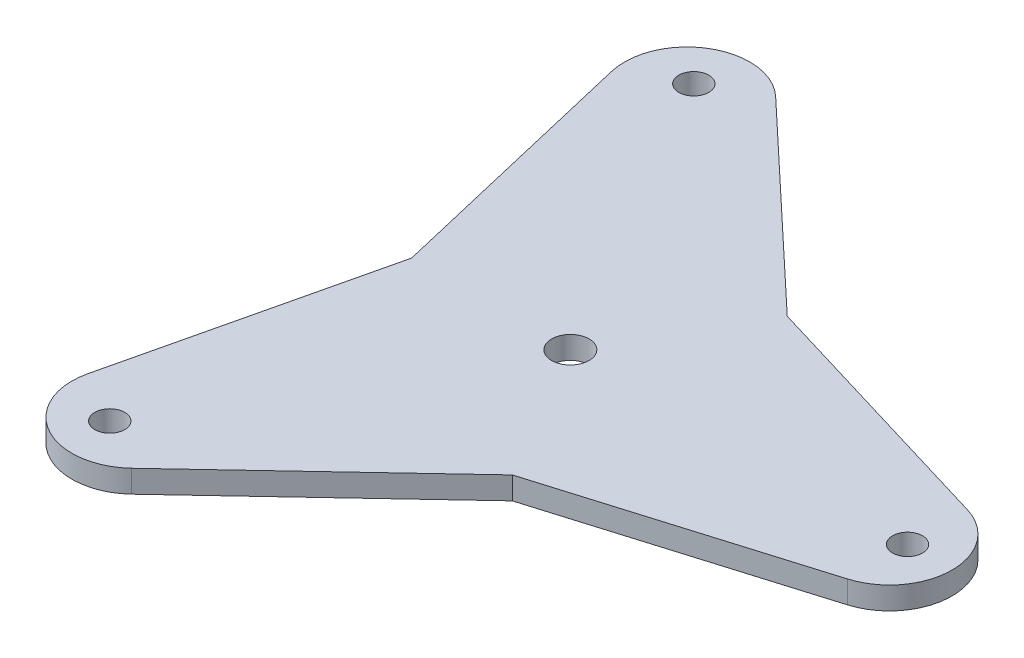
from build123d import *

# Parameters (mm, degrees)
SKETCH2_R           = 2.5
SKETCH2_R_2         = 2
BOSS_EXTRUDE2_DEPTH = 3


with BuildPart() as part:
    # Sketch2 → Boss-Extrude2 (new body)
    with BuildSketch(Plane(origin=(0, 0, 0), x_dir=(1, 0, 0), z_dir=(0, 1, 0))):
        with BuildLine():
            Line((10.594452967, -18.350130817), (45, -8))
            ThreePointArc((45, -8), (50.947530499, 0), (45, 8))
            Line((45, 8), (10.594452967, 18.350130817))
            Line((10.594452967, 18.350130817), (-15.57179677, 42.97114317))
            ThreePointArc((-15.57179677, 42.97114317), (-25.473765249, 44.121855672), (-29.42820323, 34.97114317))
            Line((-29.42820323, 34.97114317), (-21.188905934, 0))
            Line((-21.188905934, 0), (-29.42820323, -34.97114317))
            ThreePointArc((-29.42820323, -34.97114317), (-25.473765249, -44.121855672), (-15.57179677, -42.97114317))
            Line((-15.57179677, -42.97114317), (10.594452967, -18.350130817))
        make_face()
        Circle(SKETCH2_R, mode=Mode.SUBTRACT)
        with Locations((-22.50172491, 38.974130802)):
            Circle(SKETCH2_R_2, mode=Mode.SUBTRACT)
        with Locations((45.00344982, 0)):
            Circle(SKETCH2_R_2, mode=Mode.SUBTRACT)
        with Locations((-22.50172491, -38.974130802)):
            Circle(SKETCH2_R_2, mode=Mode.SUBTRACT)
    extrude(amount=BOSS_EXTRUDE2_DEPTH)


solid = part.part
